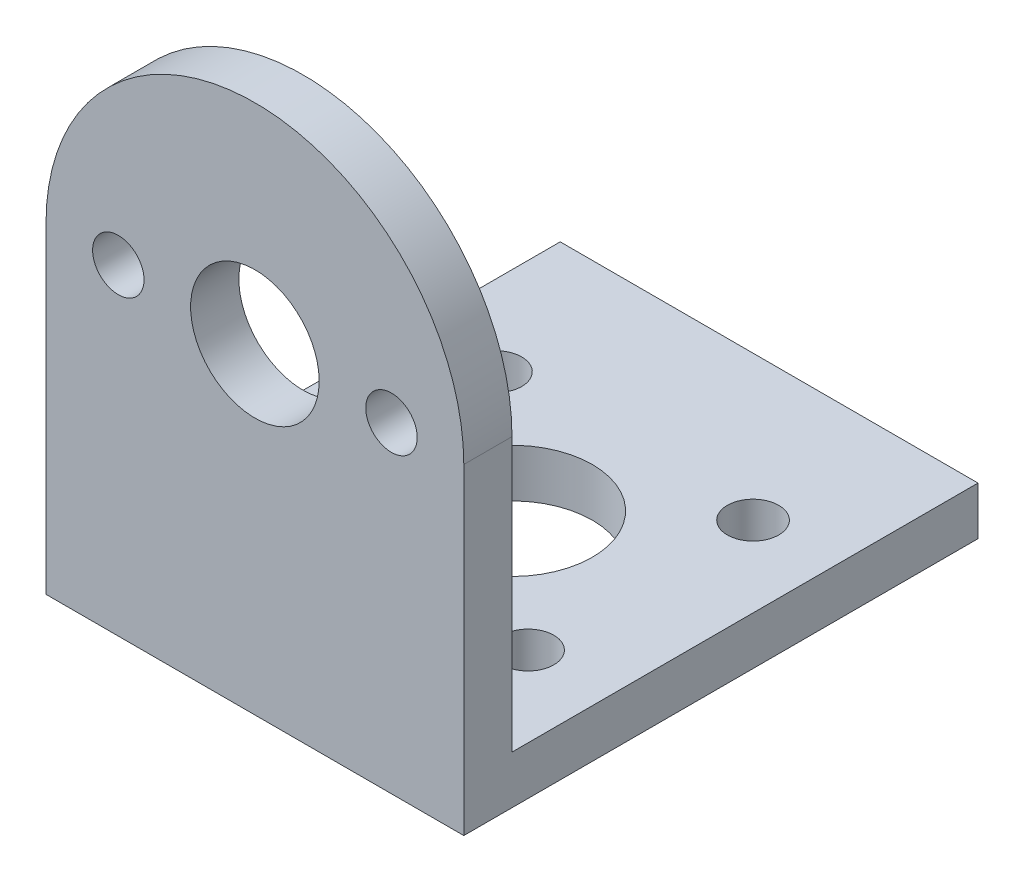
from build123d import *

# Parameters (mm, degrees)
BOSS_EXTRUDE1_DEPTH      = 3
SKETCH2_R                = 4
SKETCH2_R_2              = 1.6
CUT_EXTRUDE1_DEPTH       = 13
SKETCH3_W                = 26
SKETCH3_H                = 3
BOSS_EXTRUDE2_DEPTH      = 29
CUT_EXTRUDE3_START       = -20
CUT_EXTRUDE3_OUTLINE_R   = 1.6
CUT_EXTRUDE3_OUTLINE_R_2 = 5
CUT_EXTRUDE3_DEPTH       = 3


# Read off the part's stored shape, not the designer's step: Cut-Extrude3
with BuildPart() as part:
    # Sketch1 → Boss-Extrude1 (new body)
    with BuildSketch(Plane.XY):
        with BuildLine():
            Line((0, 0), (0, -20))
            Line((0, -20), (26, -20))
            Line((26, -20), (26, 0))
            ThreePointArc((26, 0), (13, 13), (0, 0))
        make_face()
    extrude(amount=BOSS_EXTRUDE1_DEPTH)

    # Sketch2 → Cut-Extrude1 (cut)
    with BuildSketch(Plane.XY.offset(3)):
        with Locations((13, 0)):
            Circle(SKETCH2_R)
        with Locations((4.5, 0)):
            Circle(SKETCH2_R_2)
        with Locations((21.5, 0)):
            Circle(SKETCH2_R_2)
    extrude(amount=-CUT_EXTRUDE1_DEPTH, mode=Mode.SUBTRACT)

    # Sketch3 → Boss-Extrude2 (add)
    with BuildSketch(Plane(origin=(0, 0, 0), x_dir=(-1, 0, 0), z_dir=(0, 0, -1))):
        with Locations((-13, -18.5)):
            Rectangle(SKETCH3_W, SKETCH3_H)
    extrude(amount=BOSS_EXTRUDE2_DEPTH)

    # Cut-Extrude3 outline → Cut-Extrude3 (cut)
    with BuildSketch(Plane(origin=(0, 0, 0), x_dir=(1, 0, 0), z_dir=(0, 1, 0)).offset(CUT_EXTRUDE3_START)):
        with Locations((5, 20)):
            Circle(CUT_EXTRUDE3_OUTLINE_R)
        with Locations((21, 6)):
            Circle(CUT_EXTRUDE3_OUTLINE_R)
        with Locations((21, 20)):
            Circle(CUT_EXTRUDE3_OUTLINE_R)
        with Locations((13, 13)):
            Circle(CUT_EXTRUDE3_OUTLINE_R_2)
        with Locations((5, 6)):
            Circle(CUT_EXTRUDE3_OUTLINE_R)
    extrude(amount=CUT_EXTRUDE3_DEPTH, mode=Mode.SUBTRACT)


solid = part.part
